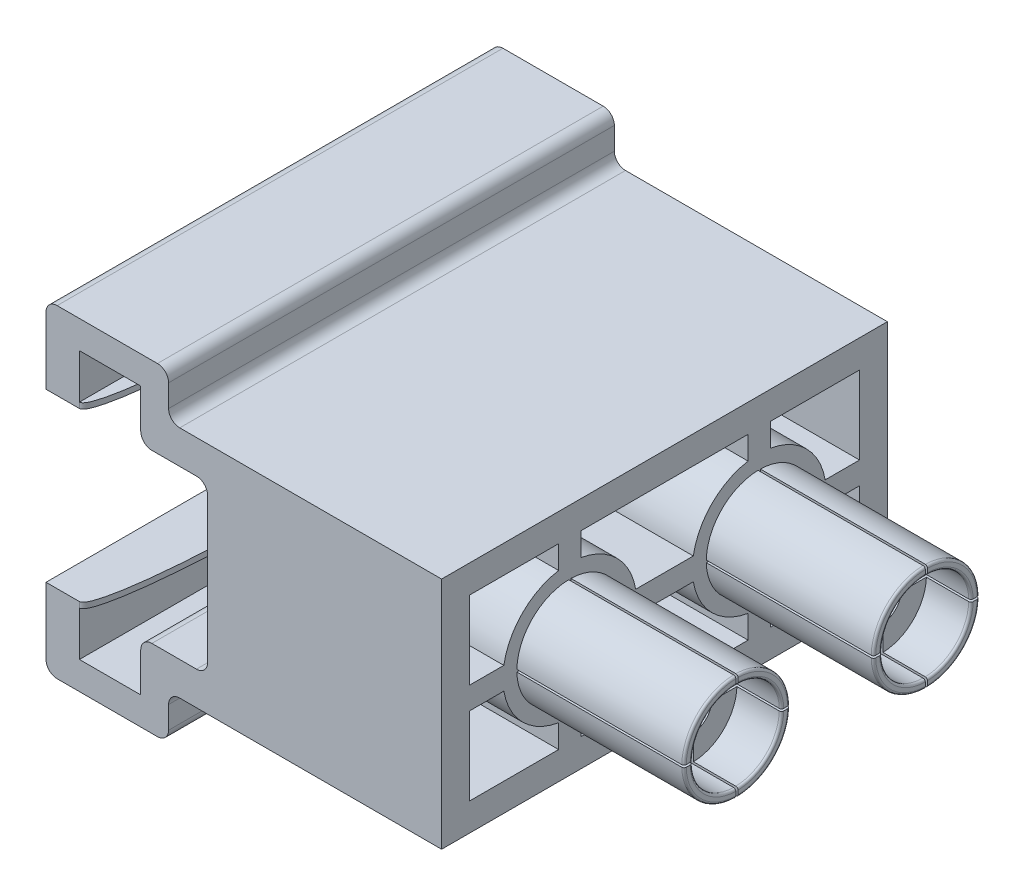
from build123d import *

# Parameters (mm, degrees)
DODANIE_WYCI_GNI_CIE1_DEPTH = 40
ZAOKR_GLENIE4_SIZE          = 19
ZAOKR_GLENIE4_SIZE_2        = 2
ZAOKR_GLENIE14_SIZE         = 2
ZAOKR_GLENIE14_SIZE_2       = 19
ZAOKR_GLENIE25_SIZE         = 19
ZAOKR_GLENIE25_SIZE_2       = 2
SZKIC2_W                    = 35
SZKIC2_H                    = 16
WYTNIJ_WYCI_GNI_CIE1_DEPTH  = 19
DODANIE_WYCI_GNI_CIE2_DEPTH = 19
SZKIC4_R                    = 2.5
WYTNIJ_WYCI_GNI_CIE2_DEPTH  = 22
SZKIC5_W                    = 2.5
SZKIC5_H                    = 17.720948116
DODANIE_WYCI_GNI_CIE3_DEPTH = 6
DODANIE_WYCI_GNI_CIE4_DEPTH = 15
SFAZOWANIE1_SIZE            = 2
SZKIC8_R                    = 4
WYTNIJ_WYCI_GNI_CIE3_DEPTH  = 4
ZAOKR_GLENIE26_R            = 0.2


with BuildPart() as part:
    # Szkic1 → Dodanie-wyciągnięcie1 (new body)
    with BuildSketch(Plane.XY):
        with BuildLine():
            Line((35.5, 25), (35.5, 4))
            Line((35.5, 4), (12, 4))
            ThreePointArc((12, 4), (11.292893219, 3.707106781), (11, 3))
            Line((11, 3), (11, 1))
            ThreePointArc((11, 1), (10.707106781, 0.292893219), (10, 0))
            Line((10, 0), (1, 0))
            ThreePointArc((1, 0), (0.292893219, 0.292893219), (0, 1))
            Line((0, 1), (0, 7))
            Line((0, 7), (5, 7))
            Line((5, 7), (5, 6.5))
            Line((5, 6.5), (3, 6.5))
            Line((3, 6.5), (3, 2.5))
            Line((3, 2.5), (8.5, 2.5))
            Line((8.5, 2.5), (8.5, 6))
            ThreePointArc((8.5, 6), (8.792893219, 6.707106781), (9.5, 7))
            Line((9.5, 7), (13.5, 7))
            ThreePointArc((13.5, 7), (14.207106781, 7.292893219), (14.5, 8))
            Line((14.5, 8), (14.5, 21))
            ThreePointArc((14.5, 21), (14.207106781, 21.707106781), (13.5, 22))
            Line((13.5, 22), (9.5, 22))
            ThreePointArc((9.5, 22), (8.792893219, 22.292893219), (8.5, 23))
            Line((8.5, 23), (8.5, 26.5))
            Line((8.5, 26.5), (3, 26.5))
            Line((3, 26.5), (3, 22.5))
            Line((3, 22.5), (5, 22.5))
            Line((5, 22.5), (5, 22))
            Line((5, 22), (0, 22))
            Line((0, 22), (0, 28))
            ThreePointArc((0, 28), (0.292893219, 28.707106781), (1, 29))
            Line((1, 29), (10, 29))
            ThreePointArc((10, 29), (10.707106781, 28.707106781), (11, 28))
            Line((11, 28), (11, 26))
            ThreePointArc((11, 26), (11.292893219, 25.292893219), (12, 25))
            Line((12, 25), (35.5, 25))
        make_face()
    extrude(amount=DODANIE_WYCI_GNI_CIE1_DEPTH)

    # Zaokrąglenie4
    # an asymmetric fillet: 19, 2 mm, written as the material it takes off along each edge
    with BuildSketch(Plane(origin=(5, 54.5, 0), x_dir=(0, 0, 1), z_dir=(0, -1, 0))) as zaokr_glenie4_piece_1_section:
        with BuildLine():
            Bezier((ZAOKR_GLENIE4_SIZE, 0), (0, 0), (0, ZAOKR_GLENIE4_SIZE_2), weights=[1, 0.707106781, 1])
            Line((0, ZAOKR_GLENIE4_SIZE_2), (0, 0))
            Line((0, 0), (ZAOKR_GLENIE4_SIZE, 0))
        make_face()
    zaokr_glenie4_piece_1 = extrude(amount=95.5, mode=Mode.PRIVATE)
    zaokr_glenie4_piece_1 = split(zaokr_glenie4_piece_1, bisect_by=Plane(origin=(4.553264043, 2.5, 4.243989755), z_dir=(0, 1, 0)), keep=Keep.TOP, mode=Mode.PRIVATE)
    zaokr_glenie4_piece_1 = split(zaokr_glenie4_piece_1, bisect_by=Plane(origin=(4.553264043, 22, 4.243989755), z_dir=(0, -1, 0)), keep=Keep.TOP, mode=Mode.PRIVATE)
    add(zaokr_glenie4_piece_1, mode=Mode.SUBTRACT)
    with BuildSketch(Plane(origin=(5, 54.5, 40), x_dir=(0, 0, -1), z_dir=(0, -1, 0))) as zaokr_glenie4_piece_2_section:
        with BuildLine():
            Bezier((ZAOKR_GLENIE4_SIZE, 0), (0, 0), (0, -ZAOKR_GLENIE4_SIZE_2), weights=[1, 0.707106781, 1])
            Line((0, -ZAOKR_GLENIE4_SIZE_2), (0, 0))
            Line((0, 0), (ZAOKR_GLENIE4_SIZE, 0))
        make_face()
    zaokr_glenie4_piece_2 = extrude(amount=95.5, mode=Mode.PRIVATE)
    zaokr_glenie4_piece_2 = split(zaokr_glenie4_piece_2, bisect_by=Plane(origin=(4.553264043, 2.5, 35.756010245), z_dir=(0, 1, 0)), keep=Keep.TOP, mode=Mode.PRIVATE)
    zaokr_glenie4_piece_2 = split(zaokr_glenie4_piece_2, bisect_by=Plane(origin=(4.553264043, 22, 35.756010245), z_dir=(0, -1, 0)), keep=Keep.TOP, mode=Mode.PRIVATE)
    add(zaokr_glenie4_piece_2, mode=Mode.SUBTRACT)

    # Zaokrąglenie14
    # an asymmetric fillet: 19, 2 mm, written as the material it takes off along each edge
    with BuildSketch(Plane(origin=(5, 70, 40), x_dir=(-1, 0, 0), z_dir=(0, -1, 0))) as zaokr_glenie14_piece_1_section:
        with BuildLine():
            Bezier((ZAOKR_GLENIE14_SIZE, 0), (0, 0), (0, ZAOKR_GLENIE14_SIZE_2), weights=[1, 0.707106781, 1])
            Line((0, ZAOKR_GLENIE14_SIZE_2), (0, 0))
            Line((0, 0), (ZAOKR_GLENIE14_SIZE, 0))
        make_face()
    zaokr_glenie14_piece_1 = extrude(amount=95.5, mode=Mode.PRIVATE)
    zaokr_glenie14_piece_1 = split(zaokr_glenie14_piece_1, bisect_by=Plane(origin=(4.553264043, 26.5, 35.756010245), z_dir=(0, -1, 0)), keep=Keep.TOP, mode=Mode.PRIVATE)
    zaokr_glenie14_piece_1 = split(zaokr_glenie14_piece_1, bisect_by=Plane(origin=(4.553264043, 7, 35.756010245), z_dir=(0, 1, 0)), keep=Keep.TOP, mode=Mode.PRIVATE)
    add(zaokr_glenie14_piece_1, mode=Mode.SUBTRACT)

    # Zaokrąglenie25
    # an asymmetric fillet: 19, 2 mm, written as the material it takes off along each edge
    with BuildSketch(Plane(origin=(5, 70, 0), x_dir=(0, 0, 1), z_dir=(0, -1, 0))) as zaokr_glenie25_piece_1_section:
        with BuildLine():
            Bezier((ZAOKR_GLENIE25_SIZE, 0), (0, 0), (0, ZAOKR_GLENIE25_SIZE_2), weights=[1, 0.707106781, 1])
            Line((0, ZAOKR_GLENIE25_SIZE_2), (0, 0))
            Line((0, 0), (ZAOKR_GLENIE25_SIZE, 0))
        make_face()
    zaokr_glenie25_piece_1 = extrude(amount=95.5, mode=Mode.PRIVATE)
    zaokr_glenie25_piece_1 = split(zaokr_glenie25_piece_1, bisect_by=Plane(origin=(4.553264043, 26.5, 4.243989755), z_dir=(0, -1, 0)), keep=Keep.TOP, mode=Mode.PRIVATE)
    zaokr_glenie25_piece_1 = split(zaokr_glenie25_piece_1, bisect_by=Plane(origin=(4.553264043, 7, 4.243989755), z_dir=(0, 1, 0)), keep=Keep.TOP, mode=Mode.PRIVATE)
    add(zaokr_glenie25_piece_1, mode=Mode.SUBTRACT)

    # Szkic2 → Wytnij-wyciągnięcie1 (cut)
    with BuildSketch(Plane(origin=(35.5, 0, 0), x_dir=(0, 0, -1), z_dir=(1, 0, 0))):
        with Locations((-20, 14.5)):
            Rectangle(SZKIC2_W, SZKIC2_H)
    extrude(amount=-WYTNIJ_WYCI_GNI_CIE1_DEPTH, mode=Mode.SUBTRACT)

    # Szkic3 → Dodanie-wyciągnięcie2 (add)
    with BuildSketch(Plane(origin=(35.5, 0, 0), x_dir=(0, 0, -1), z_dir=(1, 0, 0))):
        with BuildLine():
            Line((-22.583920217, 13.5), (-17.416079783, 13.5))
            ThreePointArc((-17.416079783, 13.5), (-15.742640687, 10.257359313), (-12.5, 8.583920217))
            Line((-12.5, 8.583920217), (-12.5, 6.5))
            Line((-12.5, 6.5), (-10.5, 6.5))
            Line((-10.5, 6.5), (-10.5, 8.583920217))
            ThreePointArc((-10.5, 8.583920217), (-7.257359313, 10.257359313), (-5.583920217, 13.5))
            Line((-5.583920217, 13.5), (-2.5, 13.5))
            Line((-2.5, 13.5), (-2.5, 15.5))
            Line((-2.5, 15.5), (-5.583920217, 15.5))
            ThreePointArc((-5.583920217, 15.5), (-7.257359313, 18.742640687), (-10.5, 20.416079783))
            Line((-10.5, 20.416079783), (-10.5, 22.5))
            Line((-10.5, 22.5), (-12.5, 22.5))
            Line((-12.5, 22.5), (-12.5, 20.416079783))
            ThreePointArc((-12.5, 20.416079783), (-15.742640687, 18.742640687), (-17.416079783, 15.5))
            Line((-17.416079783, 15.5), (-22.583920217, 15.5))
            ThreePointArc((-22.583920217, 15.5), (-24.257359313, 18.742640687), (-27.5, 20.416079783))
            Line((-27.5, 20.416079783), (-27.5, 22.5))
            Line((-27.5, 22.5), (-29.5, 22.5))
            Line((-29.5, 22.5), (-29.5, 20.416079783))
            ThreePointArc((-29.5, 20.416079783), (-32.742640687, 18.742640687), (-34.416079783, 15.5))
            Line((-34.416079783, 15.5), (-37.5, 15.5))
            Line((-37.5, 15.5), (-37.5, 13.5))
            Line((-37.5, 13.5), (-34.416079783, 13.5))
            ThreePointArc((-34.416079783, 13.5), (-32.742640687, 10.257359313), (-29.5, 8.583920217))
            Line((-29.5, 8.583920217), (-29.5, 6.5))
            Line((-29.5, 6.5), (-27.5, 6.5))
            Line((-27.5, 6.5), (-27.5, 8.583920217))
            ThreePointArc((-27.5, 8.583920217), (-24.257359313, 10.257359313), (-22.583920217, 13.5))
        make_face()
    extrude(amount=-DODANIE_WYCI_GNI_CIE2_DEPTH)

    # Szkic4 → Wytnij-wyciągnięcie2 (cut)
    with BuildSketch(Plane(origin=(35.5, 0, 0), x_dir=(0, 0, -1), z_dir=(1, 0, 0))):
        with Locations(Location((-11.5, 14.5, 0), (0, 0, 90))):
            Circle(SZKIC4_R)
        with Locations(Location((-28.5, 14.5, 0), (0, 0, 90))):
            Circle(SZKIC4_R)
    extrude(amount=-WYTNIJ_WYCI_GNI_CIE2_DEPTH, mode=Mode.SUBTRACT)

    # Szkic5 → Dodanie-wyciągnięcie3 (add)
    with BuildSketch(Plane.ZY.offset(-14.5)):
        with Locations((20, 14.486061236)):
            Rectangle(SZKIC5_W, SZKIC5_H)
    extrude(amount=DODANIE_WYCI_GNI_CIE3_DEPTH)

    # Szkic6 → Dodanie-wyciągnięcie4 (add)
    with BuildSketch(Plane(origin=(35.5, 0, 0), x_dir=(0, 0, -1), z_dir=(1, 0, 0))):
        with BuildLine():
            Line((-11.4, 12.752859479), (-11.4, 9.751052748))
            ThreePointArc((-11.4, 9.751052748), (-8.141242789, 11.141242789), (-6.751052748, 14.4))
            Line((-6.751052748, 14.4), (-9.752859479, 14.4))
            ThreePointArc((-9.752859479, 14.4), (-10.262563133, 13.262563133), (-11.4, 12.752859479))
        make_face()
        with BuildLine():
            Line((-11.6, 12.752859479), (-11.6, 9.751052748))
            ThreePointArc((-11.6, 9.751052748), (-14.858757211, 11.141242789), (-16.248947252, 14.4))
            Line((-16.248947252, 14.4), (-13.247140521, 14.4))
            ThreePointArc((-13.247140521, 14.4), (-12.737436867, 13.262563133), (-11.6, 12.752859479))
        make_face()
        with BuildLine():
            Line((-28.6, 19.248947252), (-28.6, 16.247140521))
            ThreePointArc((-28.6, 16.247140521), (-29.737436867, 15.737436867), (-30.247140521, 14.6))
            Line((-30.247140521, 14.6), (-33.248947252, 14.6))
            ThreePointArc((-33.248947252, 14.6), (-31.858757211, 17.858757211), (-28.6, 19.248947252))
        make_face()
        with BuildLine():
            Line((-33.248947252, 14.4), (-30.247140521, 14.4))
            ThreePointArc((-30.247140521, 14.4), (-29.737436867, 13.262563133), (-28.6, 12.752859479))
            Line((-28.6, 12.752859479), (-28.6, 9.751052748))
            ThreePointArc((-28.6, 9.751052748), (-31.858757211, 11.141242789), (-33.248947252, 14.4))
        make_face()
        with BuildLine():
            Line((-11.6, 19.248947252), (-11.6, 16.247140521))
            ThreePointArc((-11.6, 16.247140521), (-12.737436867, 15.737436867), (-13.247140521, 14.6))
            Line((-13.247140521, 14.6), (-16.248947252, 14.6))
            ThreePointArc((-16.248947252, 14.6), (-14.858757211, 17.858757211), (-11.6, 19.248947252))
        make_face()
        with BuildLine():
            Line((-28.4, 19.248947252), (-28.4, 16.247140521))
            ThreePointArc((-28.4, 16.247140521), (-27.262563133, 15.737436867), (-26.752859479, 14.6))
            Line((-26.752859479, 14.6), (-23.751052748, 14.6))
            ThreePointArc((-23.751052748, 14.6), (-25.141242789, 17.858757211), (-28.4, 19.248947252))
        make_face()
        with BuildLine():
            Line((-11.4, 19.248947252), (-11.4, 16.247140521))
            ThreePointArc((-11.4, 16.247140521), (-10.262563133, 15.737436867), (-9.752859479, 14.6))
            Line((-9.752859479, 14.6), (-6.751052748, 14.6))
            ThreePointArc((-6.751052748, 14.6), (-8.141242789, 17.858757211), (-11.4, 19.248947252))
        make_face()
        with BuildLine():
            Line((-26.752859479, 14.4), (-23.751052748, 14.4))
            ThreePointArc((-23.751052748, 14.4), (-25.141242789, 11.141242789), (-28.4, 9.751052748))
            Line((-28.4, 9.751052748), (-28.4, 12.752859479))
            ThreePointArc((-28.4, 12.752859479), (-27.262563133, 13.262563133), (-26.752859479, 14.4))
        make_face()
    extrude(amount=DODANIE_WYCI_GNI_CIE4_DEPTH)

    # Sfazowanie1
    # the kernel refuses this chamfer: 2 mm, written as the material it takes off along each edge
    with BuildSketch(Plane(origin=(35.5, 14.5, 28.5), x_dir=(0, -0.7048818539423614, -0.709324729572274), z_dir=(2.1093981608227258e-15, -0.709324729572274, 0.7048818539423614))) as sfazowanie1_piece_1_section:
        Polygon((1.75 + SFAZOWANIE1_SIZE, 0), (1.75, SFAZOWANIE1_SIZE), (1.75, 0), align=None)
    sfazowanie1_piece_1 = revolve(axis=Axis((35.5, 14.5, 28.5), (1, 0, 0)), revolution_arc=359.64, mode=Mode.PRIVATE)
    sfazowanie1_piece_1 = sfazowanie1_piece_1 & Plane(origin=(37.134936163, 14.5, 28.5), x_dir=(0, 1, 0), z_dir=(1, 0, 0)) * Cylinder(2.5, 16, mode=Mode.PRIVATE)
    add(sfazowanie1_piece_1, mode=Mode.SUBTRACT)
    with BuildSketch(Plane(origin=(35.5, 14.5, 28.5), x_dir=(-4.060244204343439e-15, 0.7093247295722739, -0.7048818539423612), z_dir=(2.0961858854123457e-15, -0.7048818539423612, -0.7093247295722739))) as sfazowanie1_piece_2_section:
        Polygon((1.75 + SFAZOWANIE1_SIZE, 0), (1.75, SFAZOWANIE1_SIZE), (1.75, 0), align=None)
    sfazowanie1_piece_2 = revolve(axis=Axis((35.5, 14.5, 28.5), (1, 0, 0)), revolution_arc=359.64, mode=Mode.PRIVATE)
    sfazowanie1_piece_2 = sfazowanie1_piece_2 & Plane(origin=(37.134936163, 14.5, 28.5), x_dir=(0, 1, 0), z_dir=(1, 0, 0)) * Cylinder(2.5, 15, mode=Mode.PRIVATE)
    add(sfazowanie1_piece_2, mode=Mode.SUBTRACT)
    with BuildSketch(Plane(origin=(35.5, 14.5, 28.5), x_dir=(-4.060244204343428e-15, 0.7048818539423624, 0.709324729572273), z_dir=(-2.1093981608227222e-15, 0.709324729572273, -0.7048818539423624))) as sfazowanie1_piece_3_section:
        Polygon((1.75 + SFAZOWANIE1_SIZE, 0), (1.75, SFAZOWANIE1_SIZE), (1.75, 0), align=None)
    sfazowanie1_piece_3 = revolve(axis=Axis((35.5, 14.5, 28.5), (1, 0, 0)), revolution_arc=359.64, mode=Mode.PRIVATE)
    sfazowanie1_piece_3 = sfazowanie1_piece_3 & Plane(origin=(37.134936163, 14.5, 28.5), x_dir=(0, 1, 0), z_dir=(1, 0, 0)) * Cylinder(2.5, 16, mode=Mode.PRIVATE)
    add(sfazowanie1_piece_3, mode=Mode.SUBTRACT)
    with BuildSketch(Plane(origin=(35.5, 14.5, 28.5), x_dir=(0, -0.7048818539423629, 0.7093247295722724), z_dir=(2.1093981608227206e-15, -0.7093247295722724, -0.7048818539423629))) as sfazowanie1_piece_4_section:
        Polygon((1.75 + SFAZOWANIE1_SIZE, 0), (1.75, -SFAZOWANIE1_SIZE), (1.75, 0), align=None)
    sfazowanie1_piece_4 = revolve(axis=Axis((35.5, 14.5, 28.5), (-1, 0, 0)), revolution_arc=359.64, mode=Mode.PRIVATE)
    sfazowanie1_piece_4 = sfazowanie1_piece_4 & Plane(origin=(37.134936163, 14.5, 28.5), x_dir=(0, 1, 0), z_dir=(1, 0, 0)) * Cylinder(2.5, 15, mode=Mode.PRIVATE)
    add(sfazowanie1_piece_4, mode=Mode.SUBTRACT)
    with BuildSketch(Plane(origin=(35.5, 14.5, 11.5), x_dir=(-4.060244204343433e-15, 0.709324729572274, -0.7048818539423614), z_dir=(2.096185885412346e-15, -0.7048818539423614, -0.709324729572274))) as sfazowanie1_piece_5_section:
        Polygon((1.75 + SFAZOWANIE1_SIZE, 0), (1.75, SFAZOWANIE1_SIZE), (1.75, 0), align=None)
    sfazowanie1_piece_5 = revolve(axis=Axis((35.5, 14.5, 11.5), (1, 0, 0)), revolution_arc=359.64, mode=Mode.PRIVATE)
    sfazowanie1_piece_5 = sfazowanie1_piece_5 & Plane(origin=(37.134936163, 14.5, 11.5), x_dir=(0, 1, 0), z_dir=(1, 0, 0)) * Cylinder(2.5, 16, mode=Mode.PRIVATE)
    add(sfazowanie1_piece_5, mode=Mode.SUBTRACT)
    with BuildSketch(Plane(origin=(35.5, 14.5, 11.5), x_dir=(-4.060244204343433e-15, 0.709324729572274, 0.7048818539423614), z_dir=(2.096185885412346e-15, -0.7048818539423614, 0.709324729572274))) as sfazowanie1_piece_6_section:
        Polygon((1.75 + SFAZOWANIE1_SIZE, 0), (1.75, -SFAZOWANIE1_SIZE), (1.75, 0), align=None)
    sfazowanie1_piece_6 = revolve(axis=Axis((35.5, 14.5, 11.5), (-1, 0, 0)), revolution_arc=359.64, mode=Mode.PRIVATE)
    sfazowanie1_piece_6 = sfazowanie1_piece_6 & Plane(origin=(37.134936163, 14.5, 11.5), x_dir=(0, 1, 0), z_dir=(1, 0, 0)) * Cylinder(2.5, 15, mode=Mode.PRIVATE)
    add(sfazowanie1_piece_6, mode=Mode.SUBTRACT)
    with BuildSketch(Plane(origin=(35.5, 14.5, 11.5), x_dir=(0, -0.7048818539423612, 0.7093247295722739), z_dir=(2.1093981608227254e-15, -0.7093247295722739, -0.7048818539423612))) as sfazowanie1_piece_7_section:
        Polygon((1.75 + SFAZOWANIE1_SIZE, 0), (1.75, -SFAZOWANIE1_SIZE), (1.75, 0), align=None)
    sfazowanie1_piece_7 = revolve(axis=Axis((35.5, 14.5, 11.5), (-1, 0, 0)), revolution_arc=359.64, mode=Mode.PRIVATE)
    sfazowanie1_piece_7 = sfazowanie1_piece_7 & Plane(origin=(37.134936163, 14.5, 11.5), x_dir=(0, 1, 0), z_dir=(1, 0, 0)) * Cylinder(2.5, 15, mode=Mode.PRIVATE)
    add(sfazowanie1_piece_7, mode=Mode.SUBTRACT)
    with BuildSketch(Plane(origin=(35.5, 14.5, 11.5), x_dir=(0, -0.7048818539423614, -0.709324729572274), z_dir=(2.1093981608227258e-15, -0.709324729572274, 0.7048818539423614))) as sfazowanie1_piece_8_section:
        Polygon((1.75 + SFAZOWANIE1_SIZE, 0), (1.75, SFAZOWANIE1_SIZE), (1.75, 0), align=None)
    sfazowanie1_piece_8 = revolve(axis=Axis((35.5, 14.5, 11.5), (1, 0, 0)), revolution_arc=359.64, mode=Mode.PRIVATE)
    sfazowanie1_piece_8 = sfazowanie1_piece_8 & Plane(origin=(37.134936163, 14.5, 11.5), x_dir=(0, 1, 0), z_dir=(1, 0, 0)) * Cylinder(2.5, 15, mode=Mode.PRIVATE)
    add(sfazowanie1_piece_8, mode=Mode.SUBTRACT)

    # Szkic8 → Wytnij-wyciągnięcie3 (cut)
    with BuildSketch(Plane(origin=(50.5, 0, 0), x_dir=(0, 0, -1), z_dir=(1, 0, 0))):
        with Locations((-28.5, 14.5)):
            Circle(SZKIC8_R)
        with Locations((-11.5, 14.5)):
            Circle(SZKIC8_R)
    extrude(amount=-WYTNIJ_WYCI_GNI_CIE3_DEPTH, mode=Mode.SUBTRACT)

    # Zaokrąglenie26
    zaokr_glenie26_edges = [part.edges().sort_by_distance(p)[0] for p in [
        (50.5, 17.858757211, 8.141242789),
        (50.5, 17.858757211, 14.858757211),
        (50.5, 11.141242789, 8.141242789),
        (50.5, 11.141242789, 14.858757211),
        (50.5, 17.858757211, 25.141242789),
        (50.5, 11.141242789, 31.858757211),
        (50.5, 17.858757211, 31.858757211),
        (50.5, 11.141242789, 25.141242789),
        (50.5, 11.671572875, 25.671572875),
        (50.5, 11.671572875, 14.328427125),
        (50.5, 17.328427125, 25.671572875),
        (50.5, 11.671572875, 31.328427125),
        (50.5, 17.328427125, 31.328427125),
        (50.5, 17.328427125, 8.671572875),
        (50.5, 17.328427125, 14.328427125),
        (50.5, 11.671572875, 8.671572875),
    ]]
    fillet(zaokr_glenie26_edges, radius=ZAOKR_GLENIE26_R)


solid = part.part
